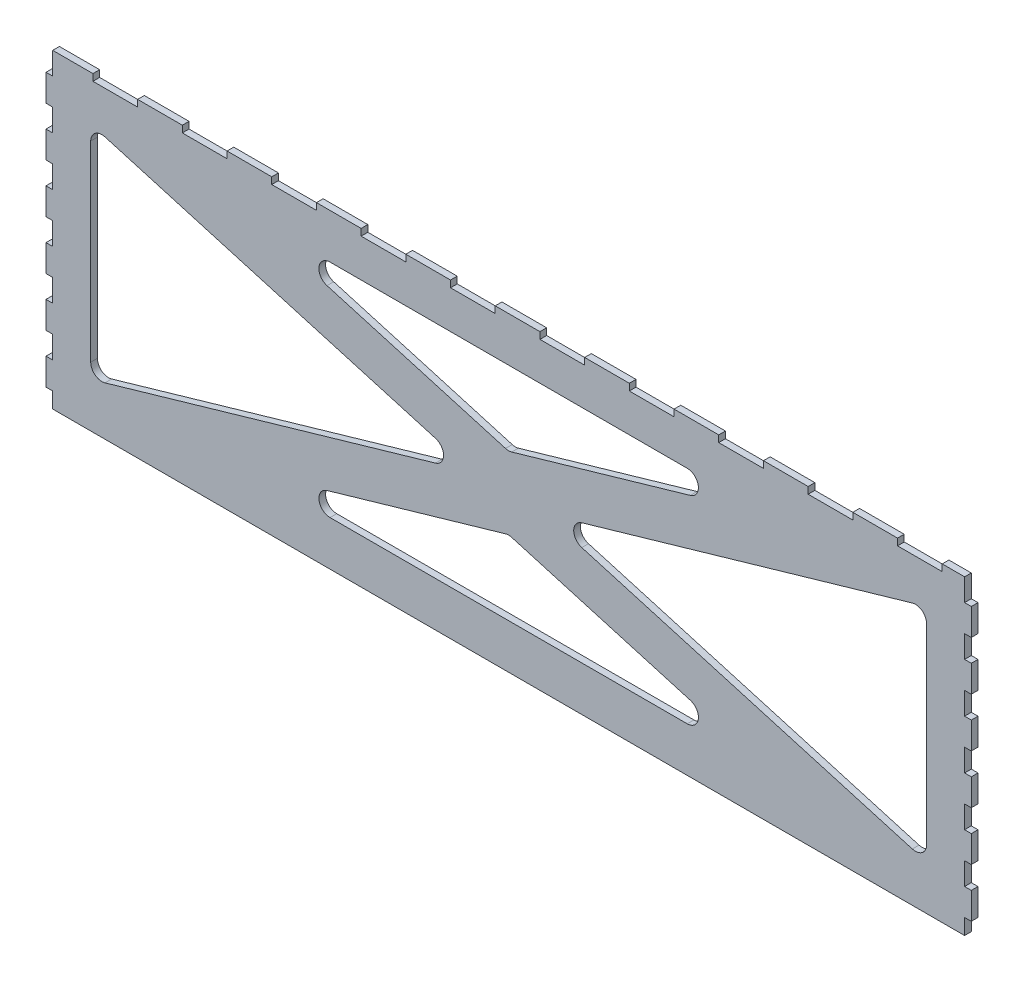
from build123d import *

# Parameters (mm, degrees)
SKETCH1_W           = 414
SKETCH1_H           = 139
BOSS_EXTRUDE1_DEPTH = 3
CUT_EXTRUDE1_DEPTH  = 3
SKETCH3_W           = 20
SKETCH3_H           = 3
CUT_EXTRUDE2_DEPTH  = 3


with BuildPart() as part:
    # Sketch1 → Boss-Extrude1 (new body)
    with BuildSketch(Plane.XY.offset(152)):
        Rectangle(SKETCH1_W, SKETCH1_H)
        with BuildLine():
            Line((-187, -42.845788224), (-187, 42.845788224))
            ThreePointArc((-187, 42.845788224), (-185.003590092, 46.843093136), (-180.608621376, 47.648294395))
            Line((-180.608621376, 47.648294395), (-32.721368552, 4.802506171))
            ThreePointArc((-32.721368552, 4.802506171), (-29.112747176, 0), (-32.721368552, -4.802506171))
            Line((-32.721368552, -4.802506171), (-180.608621376, -47.648294395))
            ThreePointArc((-180.608621376, -47.648294395), (-185.003590092, -46.843093136), (-187, -42.845788224))
        make_face(mode=Mode.SUBTRACT)
        with BuildLine():
            Line((79.902960936, 49.5), (-79.902960936, 49.5))
            ThreePointArc((-79.902960936, 49.5), (-84.853341268, 45.202662488), (-81.29433956, 39.697493829))
            Line((-81.29433956, 39.697493829), (-1.391378624, 16.548065617))
            ThreePointArc((-1.391378624, 16.548065617), (0, 16.350571788), (1.391378624, 16.548065617))
            Line((1.391378624, 16.548065617), (81.29433956, 39.697493829))
            ThreePointArc((81.29433956, 39.697493829), (84.853341268, 45.202662488), (79.902960936, 49.5))
        make_face(mode=Mode.SUBTRACT)
        with BuildLine():
            Line((180.608621376, 47.648294395), (32.721368552, 4.802506171))
            ThreePointArc((32.721368552, 4.802506171), (29.112747176, 0), (32.721368552, -4.802506171))
            Line((32.721368552, -4.802506171), (180.608621376, -47.648294395))
            ThreePointArc((180.608621376, -47.648294395), (185.003590092, -46.843093136), (187, -42.845788224))
            Line((187, -42.845788224), (187, 42.845788224))
            ThreePointArc((187, 42.845788224), (185.003590092, 46.843093136), (180.608621376, 47.648294395))
        make_face(mode=Mode.SUBTRACT)
        with BuildLine():
            Line((-81.29433956, -39.697493829), (-1.391378624, -16.548065617))
            ThreePointArc((-1.391378624, -16.548065617), (0, -16.350571788), (1.391378624, -16.548065617))
            Line((1.391378624, -16.548065617), (81.29433956, -39.697493829))
            ThreePointArc((81.29433956, -39.697493829), (84.853341268, -45.202662488), (79.902960936, -49.5))
            Line((79.902960936, -49.5), (-79.902960936, -49.5))
            ThreePointArc((-79.902960936, -49.5), (-84.853341268, -45.202662488), (-81.29433956, -39.697493829))
        make_face(mode=Mode.SUBTRACT)
    extrude(amount=BOSS_EXTRUDE1_DEPTH)

    # Sketch2 → Cut-Extrude1 (cut)
    with BuildSketch(Plane.ZY.offset(207)):
        Polygon((152, -18.5), (152, -28.5), (155, -28.5), (155, -40.5), (152, -40.5), (152, -50.5), (155, -50.5), (155, -62.5), (152, -62.5), (152, -69.5), (316, -69.5), (316, -62.5), (313, -62.5), (313, -50.5), (316, -50.5), (316, -40.5), (313, -40.5), (313, -28.5), (316, -28.5), (316, -18.5), (313, -18.5), (313, -6.5), (316, -6.5), (316, 3.5), (313, 3.5), (313, 15.5), (316, 15.5), (316, 25.5), (313, 25.5), (313, 37.5), (316, 37.5), (316, 47.5), (313, 47.5), (313, 59.5), (316, 59.5), (316, 69.5), (305, 69.5), (305, 66.5), (295, 66.5), (295, 69.5), (283, 69.5), (283, 66.5), (273, 66.5), (273, 69.5), (261, 69.5), (261, 66.5), (251, 66.5), (251, 69.5), (239, 69.5), (239, 66.5), (229, 66.5), (229, 69.5), (217, 69.5), (217, 66.5), (207, 66.5), (207, 69.5), (195, 69.5), (195, 66.5), (185, 66.5), (185, 69.5), (173, 69.5), (173, 66.5), (163, 66.5), (163, 69.5), (152, 69.5), (152, 59.5), (155, 59.5), (155, 47.5), (152, 47.5), (152, 37.5), (155, 37.5), (155, 25.5), (152, 25.5), (152, 15.5), (155, 15.5), (155, 3.5), (152, 3.5), (152, -6.5), (155, -6.5), (155, -18.5), align=None)
    cut_extrude1 = extrude(amount=-CUT_EXTRUDE1_DEPTH, mode=Mode.SUBTRACT)

    # Mirror1: Cut-Extrude1 across plane
    add(cut_extrude1.mirror(Plane(origin=(0, 0, 0), x_dir=(0, 0, 1), z_dir=(1, 0, 0))), mode=Mode.SUBTRACT)

    # Sketch3 → Cut-Extrude2 (cut)
    with BuildSketch(Plane(origin=(0, 0, 152), x_dir=(-1, 0, 0), z_dir=(0, 0, -1))):
        with Locations((-184, 68)):
            Rectangle(SKETCH3_W, SKETCH3_H)
        with Locations((-144, 68)):
            Rectangle(SKETCH3_W, SKETCH3_H)
        with Locations((-104, 68)):
            Rectangle(SKETCH3_W, SKETCH3_H)
        with Locations((-64, 68)):
            Rectangle(SKETCH3_W, SKETCH3_H)
        with Locations((-24, 68)):
            Rectangle(SKETCH3_W, SKETCH3_H)
        with Locations((16, 68)):
            Rectangle(SKETCH3_W, SKETCH3_H)
        with Locations((56, 68)):
            Rectangle(SKETCH3_W, SKETCH3_H)
        with Locations((96, 68)):
            Rectangle(SKETCH3_W, SKETCH3_H)
        with Locations((136, 68)):
            Rectangle(SKETCH3_W, SKETCH3_H)
        with Locations((176, 68)):
            Rectangle(SKETCH3_W, SKETCH3_H)
    extrude(amount=-CUT_EXTRUDE2_DEPTH, mode=Mode.SUBTRACT)


solid = part.part
